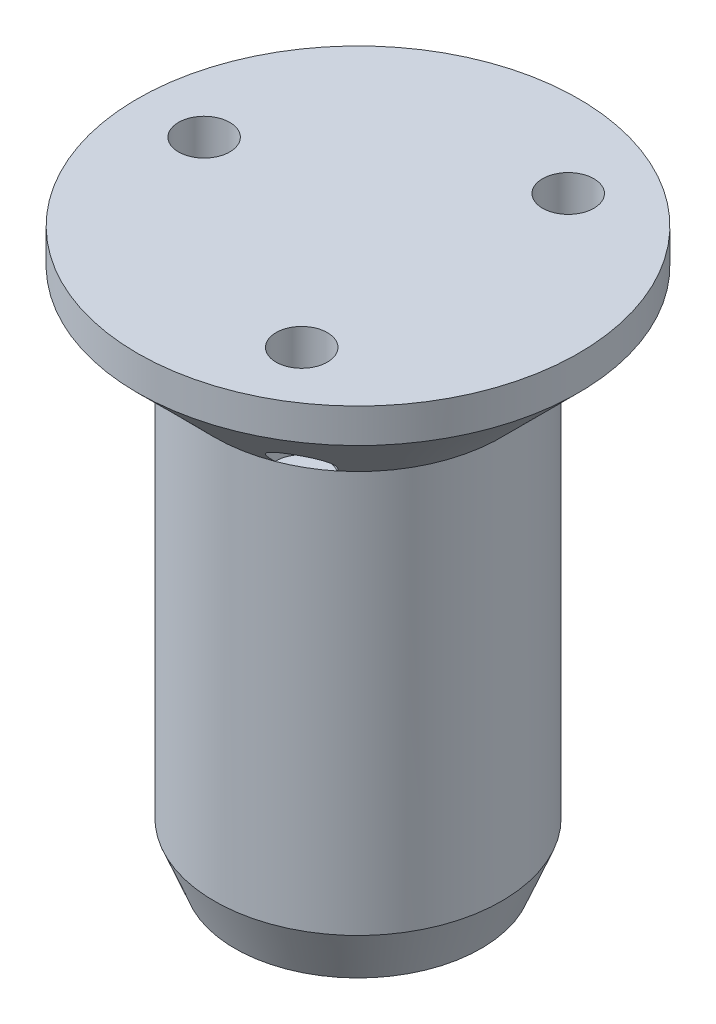
from build123d import *

# Parameters (mm, degrees)
SKETCH1_R                     = 12.9
BOSS_EXTRUDE1_DEPTH           = 2
SKETCH2_R                     = 12.9
BOSS_EXTRUDE2_DEPTH           = 4.5
BOSS_EXTRUDE2_TAPER           = 45
SKETCH3_R                     = 8.4
BOSS_EXTRUDE3_DEPTH           = 23.5
SKETCH5_R                     = 8.4
BOSS_EXTRUDE4_DEPTH           = 3
BOSS_EXTRUDE4_TAPER           = 21.8
F_6_0MM_START                 = -6.501
F_6_0MM_DOWEL_HOLE1_OUTLINE_R = 1.5
F_6_0MM_DOWEL_HOLE1_DEPTH     = 6.501


# Read off the part's stored shape, not the designer's step: Ø6.0mm Dowel Hole1
with BuildPart() as part:
    # Sketch1 → Boss-Extrude1 (new body)
    with BuildSketch(Plane(origin=(0, 0, 0), x_dir=(1, 0, 0), z_dir=(0, 1, 0))):
        with Locations(Location((0, 0, 0), (0, 0, 270))):
            Circle(SKETCH1_R)
    extrude(amount=-BOSS_EXTRUDE1_DEPTH)

    # Sketch2 → Boss-Extrude2 (add)
    with BuildSketch(Plane.XZ.offset(2)):
        with Locations(Location((0, 0, 0), (0, 0, 90))):
            Circle(SKETCH2_R)
    extrude(amount=BOSS_EXTRUDE2_DEPTH, taper=BOSS_EXTRUDE2_TAPER)

    # Sketch3 → Boss-Extrude3 (add)
    with BuildSketch(Plane.XZ.offset(6.5)):
        with Locations(Location((0, 0, 0), (0, 0, 270))):
            Circle(SKETCH3_R)
    extrude(amount=BOSS_EXTRUDE3_DEPTH)

    # Sketch5 → Boss-Extrude4 (add)
    with BuildSketch(Plane.XZ.offset(30)):
        with Locations(Location((0, 0, 0), (0, 0, 270))):
            Circle(SKETCH5_R)
    extrude(amount=BOSS_EXTRUDE4_DEPTH, taper=BOSS_EXTRUDE4_TAPER)

    # Ø6.0mm Dowel Hole1 outline → Ø6.0mm Dowel Hole1 (cut)
    with BuildSketch(Plane(origin=(0, 0, 0), x_dir=(1, 0, 0), z_dir=(0, 1, 0)).offset(F_6_0MM_START)):
        with Locations((4.5, -7.794228634)):
            Circle(F_6_0MM_DOWEL_HOLE1_OUTLINE_R)
        with Locations((4.5, 7.794228634)):
            Circle(F_6_0MM_DOWEL_HOLE1_OUTLINE_R)
        with Locations((-9, 0)):
            Circle(F_6_0MM_DOWEL_HOLE1_OUTLINE_R)
    extrude(amount=F_6_0MM_DOWEL_HOLE1_DEPTH, mode=Mode.SUBTRACT)


solid = part.part
